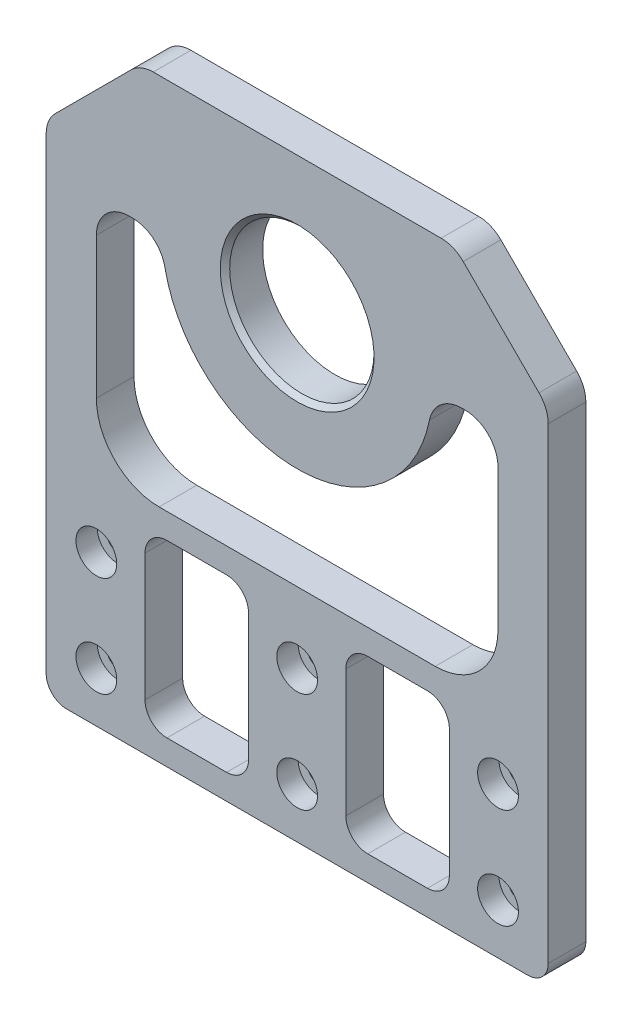
from build123d import *

# Parameters (mm, degrees)
SKETCH1_W                                           = 80
SKETCH1_H                                           = 115
BOSS_EXTRUDE1_DEPTH                                 = 6
CBORE_FOR_M3_HEX_SOCKET_HEAD_CAP_SCREW1_D           = 3.4
CBORE_FOR_M3_HEX_SOCKET_HEAD_CAP_SCREW1_CBORE_D     = 6.5
CBORE_FOR_M3_HEX_SOCKET_HEAD_CAP_SCREW1_CBORE_DEPTH = 3.4
SKETCH4_R                                           = 11.5
CUT_EXTRUDE1_DEPTH                                  = 141.2176879
CHAMFER1_SIZE                                       = 0.75
CHAMFER2_SIZE                                       = 6
CBORE_START                                         = 2.6
CBORE_FOR_M3_HEX_SOCKET_HEAD_CAP_SCR_2_R            = 3.25
CBORE_FOR_M3_HEX_SOCKET_HEAD_CAP_SCREW2_DEPTH       = 3.4
CBORE_FOR_M3_HEX_SOCKET_HEAD_CAP_SCR_3_O_R          = 1.7
CBORE_FOR_M3_HEX_SOCKET_HEAD_CAP_SCR_3_DEPTH        = 2.6
CUT_EXTRUDE2_DEPTH                                  = 141.2176879
FILLET1_R                                           = 3.25
CUT_EXTRUDE3_DEPTH                                  = 141.2176879
FILLET2_R                                           = 10
FILLET4_R                                           = 5.25
SKETCH10_W                                          = 16.5
SKETCH10_H                                          = 27.25
CUT_EXTRUDE4_DEPTH                                  = 141.2176879
FILLET5_R                                           = 3.5
SKETCH11_W                                          = 80
SKETCH11_H                                          = 20.198039027
CUT_EXTRUDE5_DEPTH                                  = 141.2176879
CHAMFER3_SIZE                                       = 15
FILLET6_R                                           = 5


# Read off the part's stored shape, not the designer's step: CBORE for M3 Hex Socket Head Cap Screw2
with BuildPart() as part:
    # Sketch1 → Boss-Extrude1 (new body)
    with BuildSketch(Plane.XY):
        with Locations((40, 57.5)):
            Rectangle(SKETCH1_W, SKETCH1_H)
    extrude(amount=BOSS_EXTRUDE1_DEPTH)

    # CBORE for M3 Hex Socket Head Cap Screw1 (through all)
    with Locations(Plane.XY.offset(6)):
        with Locations((8, 8), (40, 8), (72, 8), (40, 24), (72, 24), (8, 24)):
            CounterBoreHole(CBORE_FOR_M3_HEX_SOCKET_HEAD_CAP_SCREW1_D / 2, CBORE_FOR_M3_HEX_SOCKET_HEAD_CAP_SCREW1_CBORE_D / 2, CBORE_FOR_M3_HEX_SOCKET_HEAD_CAP_SCREW1_CBORE_DEPTH)

    # Sketch4 → Cut-Extrude1 (cut, through all)
    with BuildSketch(Plane.XY.offset(6)):
        with Locations((40, 73)):
            Circle(SKETCH4_R)
    extrude(amount=-CUT_EXTRUDE1_DEPTH, mode=Mode.SUBTRACT)

    # Chamfer1
    chamfer1_edges = [part.edges().sort_by_distance(p)[0] for p in [
        (28.5, 73, 6),
    ]]
    chamfer(chamfer1_edges, length=CHAMFER1_SIZE)

    # Chamfer2
    chamfer2_edges = [part.edges().sort_by_distance(p)[0] for p in [
        (0, 115, 3),
        (80, 115, 3),
    ]]
    chamfer(chamfer2_edges, length=CHAMFER2_SIZE)

    # CBORE for M3 Hex Socket Head Cap Scr 2 → CBORE for M3 Hex Socket Head Cap Screw2 (cut)
    with BuildSketch(Plane.XY.offset(CBORE_START)):
        with Locations((8, 105)):
            Circle(CBORE_FOR_M3_HEX_SOCKET_HEAD_CAP_SCR_2_R)
        with Locations((72, 105)):
            Circle(CBORE_FOR_M3_HEX_SOCKET_HEAD_CAP_SCR_2_R)
    extrude(amount=CBORE_FOR_M3_HEX_SOCKET_HEAD_CAP_SCREW2_DEPTH, mode=Mode.SUBTRACT)

    # CBORE for M3 Hex Socket Head Cap Scr 3 o → CBORE for M3 Hex Socket Head Cap Scr 3 (cut)
    with BuildSketch(Plane.XY):
        with Locations((8, 105)):
            Circle(CBORE_FOR_M3_HEX_SOCKET_HEAD_CAP_SCR_3_O_R)
        with Locations((72, 105)):
            Circle(CBORE_FOR_M3_HEX_SOCKET_HEAD_CAP_SCR_3_O_R)
    extrude(amount=CBORE_FOR_M3_HEX_SOCKET_HEAD_CAP_SCR_3_DEPTH, mode=Mode.SUBTRACT)

    # Sketch8 → Cut-Extrude2 (cut, through all)
    with BuildSketch(Plane.XY.offset(6)):
        Polygon((18.198039027, 105), (18.198039027, 94.801960973), (40, 94.801960973), (61.801960973, 94.801960973), (61.801960973, 105), (61.801960973, 115), (18.198039027, 115), align=None)
    extrude(amount=-CUT_EXTRUDE2_DEPTH, mode=Mode.SUBTRACT)

    # Fillet1
    fillet1_edges = [part.edges().sort_by_distance(p)[0] for p in [
        (61.801960973, 115, 3),
        (61.801960973, 94.801960973, 3),
        (18.198039027, 94.801960973, 3),
        (18.198039027, 115, 3),
        (0, 109, 3),
        (74, 115, 3),
        (6, 115, 3),
        (80, 109, 3),
        (80, 0, 3),
        (0, 0, 3),
    ]]
    fillet(fillet1_edges, radius=FILLET1_R)

    # Sketch9 → Cut-Extrude3 (cut, through all)
    with BuildSketch(Plane.XY.offset(6)):
        with BuildLine():
            Line((8, 73), (8, 35.25))
            Line((8, 35.25), (40, 35.25))
            Line((40, 35.25), (72, 35.25))
            Line((72, 35.25), (72, 73))
            Line((72, 73), (61.5, 73))
            ThreePointArc((61.5, 73), (40, 51.5), (18.5, 73))
            Line((18.5, 73), (8, 73))
        make_face()
    extrude(amount=-CUT_EXTRUDE3_DEPTH, mode=Mode.SUBTRACT)

    # Fillet2
    fillet2_edges = [part.edges().sort_by_distance(p)[0] for p in [
        (72, 35.25, 3),
        (8, 35.25, 3),
    ]]
    fillet(fillet2_edges, radius=FILLET2_R)

    # Fillet4
    fillet4_edges = [part.edges().sort_by_distance(p)[0] for p in [
        (18.5, 73, 3),
        (61.5, 73, 3),
        (72, 73, 3),
        (8, 73, 3),
    ]]
    fillet(fillet4_edges, radius=FILLET4_R)

    # Sketch10 → Cut-Extrude4 (cut, through all)
    with BuildSketch(Plane.XY.offset(6)):
        with Locations((24, 17.625)):
            Rectangle(SKETCH10_W, SKETCH10_H)
        with Locations((56, 17.625)):
            Rectangle(SKETCH10_W, SKETCH10_H)
    extrude(amount=-CUT_EXTRUDE4_DEPTH, mode=Mode.SUBTRACT)

    # Fillet5
    fillet5_edges = [part.edges().sort_by_distance(p)[0] for p in [
        (15.75, 31.25, 3),
        (32.25, 31.25, 3),
        (32.25, 4, 3),
        (15.75, 4, 3),
        (47.75, 31.25, 3),
        (64.25, 31.25, 3),
        (64.25, 4, 3),
        (47.75, 4, 3),
    ]]
    fillet(fillet5_edges, radius=FILLET5_R)

    # Sketch11 → Cut-Extrude5 (cut, through all)
    with BuildSketch(Plane.XY.offset(6)):
        with Locations((40, 104.900980487)):
            Rectangle(SKETCH11_W, SKETCH11_H)
    extrude(amount=-CUT_EXTRUDE5_DEPTH, mode=Mode.SUBTRACT)

    # Chamfer3
    chamfer3_edges = [part.edges().sort_by_distance(p)[0] for p in [
        (80, 94.801960973, 3),
        (0, 94.801960973, 3),
    ]]
    chamfer(chamfer3_edges, length=CHAMFER3_SIZE)

    # Fillet6
    fillet6_edges = [part.edges().sort_by_distance(p)[0] for p in [
        (80, 79.801960973, 3),
        (15, 94.801960973, 3),
        (65, 94.801960973, 3),
        (0, 79.801960973, 3),
    ]]
    fillet(fillet6_edges, radius=FILLET6_R)


solid = part.part
